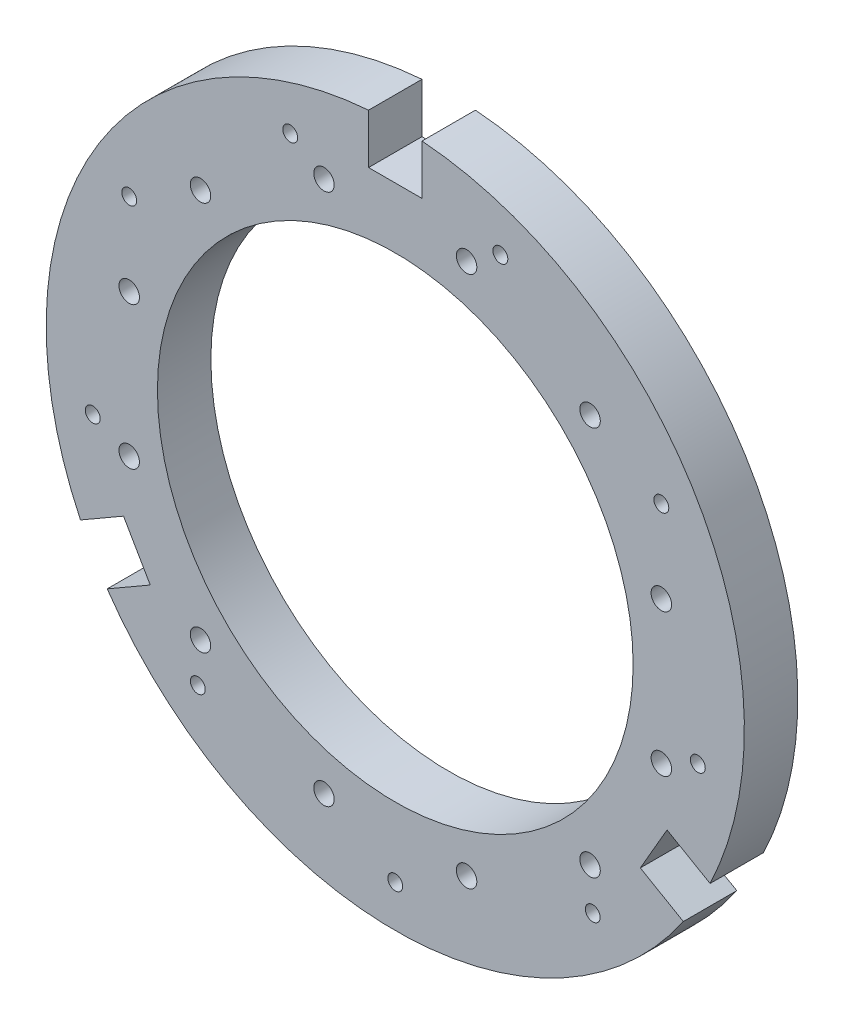
from build123d import *

# Parameters (mm, degrees)
ESQUISSE1_R        = 51.1
BOSS_EXTRU_1_DEPTH = 11.482
SKETCH2_R          = 1.6
CUT_EXTRUDE1_DEPTH = 107.685689406
CIRPATTERN1_COUNT  = 9
SKETCH3_R          = 2.2
CUT_EXTRUDE2_DEPTH = 25
CIRPATTERN2_COUNT  = 12


with BuildPart() as part:
    # Esquisse1 → Boss.-Extru.1 (new body)
    with BuildSketch(Plane.XY):
        with BuildLine():
            Line((-52.641728383, -37.021851843), (-61.890836376, -42.361826833))
            ThreePointArc((-61.890836376, -42.361826833), (0, -75), (61.890836376, -42.361826833))
            Line((61.890836376, -42.361826833), (52.641728383, -37.021851843))
            Line((52.641728383, -37.021851843), (58.382728383, -27.078148157))
            Line((58.382728383, -27.078148157), (67.631836376, -32.418123147))
            ThreePointArc((67.631836376, -32.418123147), (64.951905284, 37.5), (5.741, 74.77994998))
            Line((5.741, 74.77994998), (5.741, 64.1))
            Line((5.741, 64.1), (-5.741, 64.1))
            Line((-5.741, 64.1), (-5.741, 74.77994998))
            ThreePointArc((-5.741, 74.77994998), (-64.951905284, 37.5), (-67.631836376, -32.418123147))
            Line((-67.631836376, -32.418123147), (-58.382728383, -27.078148157))
            Line((-58.382728383, -27.078148157), (-52.641728383, -37.021851843))
        make_face()
        Circle(ESQUISSE1_R, mode=Mode.SUBTRACT)
    extrude(amount=BOSS_EXTRU_1_DEPTH)

    # Sketch2 → Cut-Extrude1 (cut, through all)
    with BuildSketch(Plane.XY.offset(11.482)):
        with Locations((22.573329459, 62.019712972)):
            Circle(SKETCH2_R)
    cut_extrude1 = extrude(amount=-CUT_EXTRUDE1_DEPTH, mode=Mode.SUBTRACT)

    # CirPattern1: Cut-Extrude1 ×9 about axis
    cirpattern1_axis = Axis((0, 0, -0.5741), (0, 0, 1))
    for i in range(1, CIRPATTERN1_COUNT):
        add(cut_extrude1.rotate(cirpattern1_axis, i * 360 / CIRPATTERN1_COUNT), mode=Mode.SUBTRACT)

    # Sketch3 → Cut-Extrude2 (cut, symmetric)
    with BuildSketch(Plane.XY):
        with Locations((15.316911089, 57.1634904)):
            Circle(SKETCH3_R)
    cut_extrude2 = extrude(amount=CUT_EXTRUDE2_DEPTH, both=True, mode=Mode.SUBTRACT)

    # CirPattern2: Cut-Extrude2 ×12 about axis
    cirpattern2_axis = Axis((0, 0, -0.5741), (0, 0, 1))
    for i in range(1, CIRPATTERN2_COUNT):
        add(cut_extrude2.rotate(cirpattern2_axis, i * 360 / CIRPATTERN2_COUNT), mode=Mode.SUBTRACT)


solid = part.part
